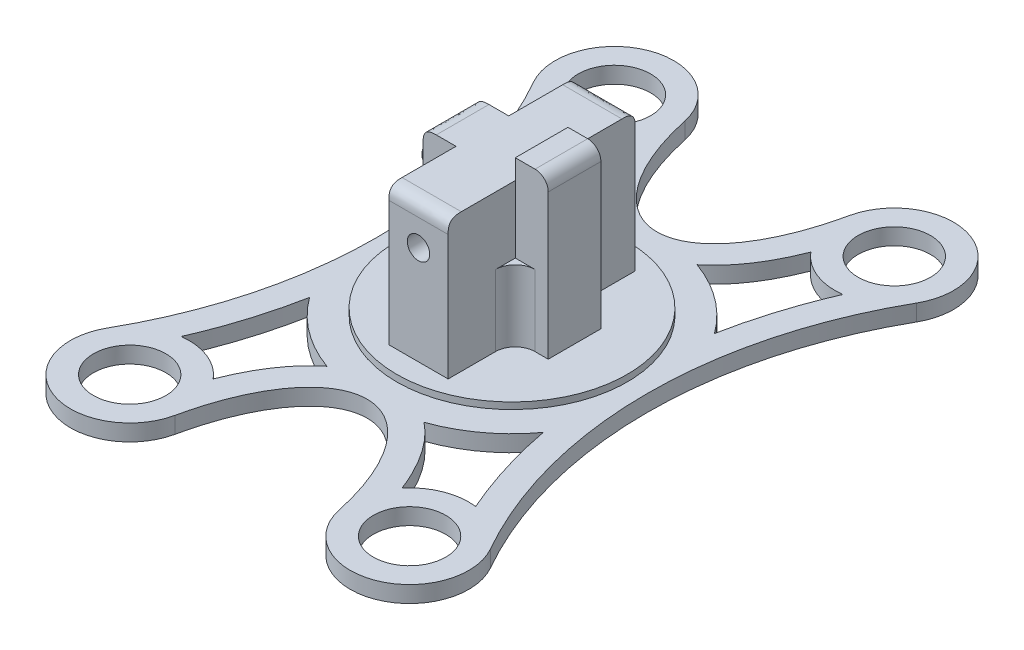
from build123d import *

# Parameters (mm, degrees)
SKETCH1_W                = 100
SKETCH1_H                = 100
BOSS_EXTRUDE1_DEPTH      = 2.5
SKETCH2_W                = 100
SKETCH2_H                = 100
SKETCH2_R                = 5.5
CUT_EXTRUDE1_DEPTH       = 10
CUT_EXTRUDE3_DEPTH       = 10
BOSS_EXTRUDE2_DEPTH      = 1
BOSS_EXTRUDE2_DEPTH_BACK = 4.5
SKETCH6_R                = 17.5
BOSS_EXTRUDE6_DEPTH      = 21
FILLET1_SIZE             = 2
FILLET2_SIZE             = 2
SKETCH12_R               = 1.7
CUT_EXTRUDE4_DEPTH       = 72.5265134
SKETCH13_R               = 1.7
BOSS_EXTRUDE8_DEPTH      = 2.5
SKETCH16_W               = 5
SKETCH16_H               = 8
BOSS_EXTRUDE9_DEPTH      = 24
FILLET3_R                = 2
BOSS_EXTRUDE10_DEPTH     = 10.8


with BuildPart() as part:
    # Sketch1 → Boss-Extrude1 (new body)
    with BuildSketch(Plane(origin=(0, 0, 0), x_dir=(1, 0, 0), z_dir=(0, 1, 0))):
        Rectangle(SKETCH1_W, SKETCH1_H)
    extrude(amount=BOSS_EXTRUDE1_DEPTH)

    # Sketch2 → Cut-Extrude1 (cut)
    # profile 1 of 5: a face of its own
    with BuildSketch(Plane(origin=(0, 2.5, 0), x_dir=(1, 0, 0), z_dir=(0, 1, 0))):
        Rectangle(SKETCH2_W, SKETCH2_H)
        with BuildLine():
            ThreePointArc((-29.074945731, -32.359707621), (-20.523161881, 0), (-29.074945731, 32.359707621))
            ThreePointArc((-29.074945731, 32.359707621), (-24.454355603, 45.216317777), (-12.450207096, 38.693841525))
            add(Edge.make_bspline(
                [(-12.450207096, 38.693841525), (0, -19.342739332), (12.450207096, 38.693841525)],
                knots=[5.128046308, 5.128046308, 5.128046308, 7.438324307, 7.438324307, 7.438324307], degree=2, weights=[1, 0.403791374, 1]))
            ThreePointArc((12.450207096, 38.693841525), (24.454355603, 45.216317777), (29.074945731, 32.359707621))
            ThreePointArc((29.074945731, 32.359707621), (20.523161881, 0), (29.074945731, -32.359707621))
            ThreePointArc((29.074945731, -32.359707621), (24.454355603, -45.216317777), (12.450207096, -38.693841525))
            add(Edge.make_bspline(
                [(12.450207096, -38.693841525), (0, 19.342739332), (-12.450207096, -38.693841525)],
                knots=[5.128046308, 5.128046308, 5.128046308, 7.438324307, 7.438324307, 7.438324307], degree=2, weights=[1, 0.403791374, 1]))
            ThreePointArc((-12.450207096, -38.693841525), (-24.454355603, -45.216317777), (-29.074945731, -32.359707621))
        make_face(mode=Mode.SUBTRACT)
    # profile 2 of 5: a face of its own
    with BuildSketch(Plane(origin=(0, 2.5, 0), x_dir=(1, 0, 0), z_dir=(0, 1, 0))):
        with Locations(Location((-21.25, 36.806079661, 0), (0, 0, 270))):
            Circle(SKETCH2_R)
    # profile 3 of 5: a face of its own
    with BuildSketch(Plane(origin=(0, 2.5, 0), x_dir=(1, 0, 0), z_dir=(0, 1, 0))):
        with Locations(Location((-21.25, -36.806079661, 0), (0, 0, 270))):
            Circle(SKETCH2_R)
    # profile 4 of 5: a face of its own
    with BuildSketch(Plane(origin=(0, 2.5, 0), x_dir=(1, 0, 0), z_dir=(0, 1, 0))):
        with Locations(Location((21.25, -36.806079661, 0), (0, 0, 270))):
            Circle(SKETCH2_R)
    # profile 5 of 5: a face of its own
    with BuildSketch(Plane(origin=(0, 2.5, 0), x_dir=(1, 0, 0), z_dir=(0, 1, 0))):
        with Locations(Location((21.25, 36.806079661, 0), (0, 0, 270))):
            Circle(SKETCH2_R)
    extrude(amount=-CUT_EXTRUDE1_DEPTH, mode=Mode.SUBTRACT)

    # Sketch4 → Cut-Extrude3 (cut)
    with BuildSketch(Plane(origin=(0, 2.5, 0), x_dir=(1, 0, 0), z_dir=(0, 1, 0))):
        with BuildLine():
            ThreePointArc((-17.749489284, -12.998293356), (-13.140045691, -17.64480658), (-7.367625104, -20.729643034))
            add(Edge.make_bspline(
                [(-7.367625104, -20.729643034), (-7.747241798, -21.030061446), (-8.114529726, -21.350348356), (-9.247106431, -22.428016295), (-9.96747496, -23.25295704), (-11.975526868, -25.945450431), (-13.113170007, -28.031524091), (-14.161311212, -30.568863064), (-14.254109179, -30.800153833), (-14.345065296, -31.033569225)],
                knots=[0.658936879, 0.658936879, 0.658936879, 0.658936879, 0.6875, 0.6875, 0.75, 0.75, 0.875, 0.875, 0.887405876, 0.887405876, 0.887405876, 0.887405876], degree=3))
            ThreePointArc((-14.345065296, -31.033569225), (-17.949067849, -28.433275654), (-22.357942029, -27.874536431))
            add(Edge.make_bspline(
                [(-17.749489284, -12.998293356), (-18.730013182, -18.148505445), (-20.279042278, -23.126345909), (-22.357942029, -27.874536431)],
                knots=[0.6784999, 0.6784999, 0.6784999, 0.6784999, 0.896036051, 0.896036051, 0.896036051, 0.896036051], degree=3, weights=[0.94303917, 0.94979881, 0.960677405, 0.975674954]))
        make_face()
        with BuildLine():
            ThreePointArc((7.367625104, -20.729643034), (13.140045691, -17.64480658), (17.749489284, -12.998293356))
            add(Edge.make_bspline(
                [(22.357942029, -27.874536431), (20.279042278, -23.126345909), (18.730013182, -18.148505445), (17.749489284, -12.998293356)],
                knots=[0.103963949, 0.103963949, 0.103963949, 0.103963949, 0.3215001, 0.3215001, 0.3215001, 0.3215001], degree=3, weights=[0.975674954, 0.960677405, 0.94979881, 0.94303917]))
            ThreePointArc((22.357942029, -27.874536431), (17.949067849, -28.433275654), (14.345065296, -31.033569225))
            add(Edge.make_bspline(
                [(14.345065296, -31.033569225), (14.254109179, -30.800153832), (14.161311212, -30.568863064), (13.113170007, -28.031524091), (11.975526868, -25.945450431), (9.96747496, -23.25295704), (9.247106431, -22.428016295), (8.114529726, -21.350348356), (7.747241798, -21.030061447), (7.367625104, -20.729643034)],
                knots=[0.112594124, 0.112594124, 0.112594124, 0.112594124, 0.125, 0.125, 0.25, 0.25, 0.3125, 0.3125, 0.341063121, 0.341063121, 0.341063121, 0.341063121], degree=3))
        make_face()
        with BuildLine():
            ThreePointArc((14.345065296, 31.033569225), (17.949067849, 28.433275654), (22.357942029, 27.874536431))
            add(Edge.make_bspline(
                [(17.749489284, 12.998293356), (18.730013182, 18.148505445), (20.279042278, 23.126345909), (22.357942029, 27.874536431)],
                knots=[0.6784999, 0.6784999, 0.6784999, 0.6784999, 0.896036051, 0.896036051, 0.896036051, 0.896036051], degree=3, weights=[0.94303917, 0.94979881, 0.960677405, 0.975674954]))
            ThreePointArc((17.749489284, 12.998293356), (13.140045691, 17.64480658), (7.367625104, 20.729643034))
            add(Edge.make_bspline(
                [(7.367625104, 20.729643034), (7.747241798, 21.030061446), (8.114529726, 21.350348356), (9.247106431, 22.428016295), (9.96747496, 23.25295704), (11.975526868, 25.945450431), (13.113170007, 28.031524091), (14.161311212, 30.568863064), (14.254109179, 30.800153833), (14.345065296, 31.033569225)],
                knots=[0.658936879, 0.658936879, 0.658936879, 0.658936879, 0.6875, 0.6875, 0.75, 0.75, 0.875, 0.875, 0.887405876, 0.887405876, 0.887405876, 0.887405876], degree=3))
        make_face()
        with BuildLine():
            ThreePointArc((-14.345065296, 31.033569225), (-17.949067849, 28.433275654), (-22.357942029, 27.874536431))
            add(Edge.make_bspline(
                [(-22.357942029, 27.874536431), (-20.279042278, 23.126345909), (-18.730013182, 18.148505445), (-17.749489284, 12.998293356)],
                knots=[0.103963949, 0.103963949, 0.103963949, 0.103963949, 0.3215001, 0.3215001, 0.3215001, 0.3215001], degree=3, weights=[0.975674954, 0.960677405, 0.94979881, 0.94303917]))
            ThreePointArc((-17.749489284, 12.998293356), (-13.140045691, 17.64480658), (-7.367625104, 20.729643034))
            add(Edge.make_bspline(
                [(-14.345065296, 31.033569225), (-14.254109179, 30.800153832), (-14.161311212, 30.568863064), (-13.113170007, 28.031524091), (-11.975526868, 25.945450431), (-9.96747496, 23.25295704), (-9.247106431, 22.428016295), (-8.114529726, 21.350348356), (-7.747241798, 21.030061447), (-7.367625104, 20.729643034)],
                knots=[0.112594124, 0.112594124, 0.112594124, 0.112594124, 0.125, 0.125, 0.25, 0.25, 0.3125, 0.3125, 0.341063121, 0.341063121, 0.341063121, 0.341063121], degree=3))
        make_face()
    extrude(amount=-CUT_EXTRUDE3_DEPTH, mode=Mode.SUBTRACT)

    # Sketch6 → Boss-Extrude2 (add, two sides: drawn at the far end of the back side and taken through both)
    with BuildSketch(Plane(origin=(0, 2.5, 0), x_dir=(1, 0, 0), z_dir=(0, 1, 0)).offset(-BOSS_EXTRUDE2_DEPTH_BACK)):
        with Locations(Location((0, 0, 0), (0, 0, 270))):
            Circle(SKETCH6_R)
    extrude(amount=BOSS_EXTRUDE2_DEPTH + BOSS_EXTRUDE2_DEPTH_BACK)

    # Sketch9 → Boss-Extrude6 (add)
    with BuildSketch(Plane(origin=(0, 3.5, 0), x_dir=(1, 0, 0), z_dir=(0, 1, 0))):
        Polygon((-4.5, 4), (-9.5, 4), (-9.5, -4), (-4.5, -4), (-4.5, -14.2), (4.5, -14.2), (4.5, 14.2), (-4.5, 14.2), align=None)
    extrude(amount=BOSS_EXTRUDE6_DEPTH)

    # Fillet1
    # a fillet whose section is not a circle: 2 mm, written as the material it takes off along each edge
    with BuildSketch(Plane(origin=(-9.5, 24.5, -9), x_dir=(0, -1, 0), z_dir=(0, 0, 1))) as fillet1_piece_1:
        with BuildLine():
            add(Edge.make_bspline([(FILLET1_SIZE, 0), (FILLET1_SIZE * 0.831801948466, 0), (FILLET1_SIZE * 0.663603896932, 0), (FILLET1_SIZE * 0.292893218813, FILLET1_SIZE * 0.0716919198361), (FILLET1_SIZE * 0.0716919198361, FILLET1_SIZE * 0.292893218813), (0, FILLET1_SIZE * 0.663603896932), (0, FILLET1_SIZE * 0.831801948466), (0, FILLET1_SIZE)], knots=[0, 0, 0, 0, 0, 0, 0.5, 0.5, 1, 1, 1, 1, 1, 1], degree=5))
            Line((0, FILLET1_SIZE), (0, 0))
            Line((0, 0), (FILLET1_SIZE, 0))
        make_face()
    extrude(amount=18, mode=Mode.SUBTRACT)

    # Fillet2
    # a fillet whose section is not a circle: 2 mm, written as the material it takes off along each edge
    with BuildSketch(Plane(origin=(-9.5, 24.5, 14.2), x_dir=(0, -1, 0), z_dir=(1, 0, 0)), Plane(origin=(9.5, 24.5, -14.2), x_dir=(0, -1, 0), z_dir=(-1, 0, 0))) as fillet2_piece_1:
        with BuildLine():
            add(Edge.make_bspline([(FILLET2_SIZE, 0), (FILLET2_SIZE * 0.831801948466, 0), (FILLET2_SIZE * 0.663603896932, 0), (FILLET2_SIZE * 0.292893218813, FILLET2_SIZE * 0.0716919198361), (FILLET2_SIZE * 0.0716919198361, FILLET2_SIZE * 0.292893218813), (0, FILLET2_SIZE * 0.663603896932), (0, FILLET2_SIZE * 0.831801948466), (0, FILLET2_SIZE)], knots=[0, 0, 0, 0, 0, 0, 0.5, 0.5, 1, 1, 1, 1, 1, 1], degree=5))
            Line((0, FILLET2_SIZE), (0, 0))
            Line((0, 0), (FILLET2_SIZE, 0))
        make_face()
    extrude(amount=19, mode=Mode.SUBTRACT)

    # Sketch12 → Cut-Extrude4 (cut, through all)
    with BuildSketch(Plane(origin=(0, 0, -14.2), x_dir=(-1, 0, 0), z_dir=(0, 0, -1))):
        with Locations((0, 18.5)):
            Circle(SKETCH12_R)
    extrude(amount=-CUT_EXTRUDE4_DEPTH, mode=Mode.SUBTRACT)

    # Sketch13 → Boss-Extrude8 (add)
    with BuildSketch(Plane.ZY.offset(9.5)):
        with Locations(Location((0, 18.5, 0), (0, 0, 180))):
            Circle(SKETCH13_R)
    extrude(amount=BOSS_EXTRUDE8_DEPTH)

    # Sketch16 → Boss-Extrude9 (add)
    with BuildSketch(Plane(origin=(0, 3.5, 0), x_dir=(1, 0, 0), z_dir=(0, 1, 0))):
        with Locations((7, 0)):
            Rectangle(SKETCH16_W, SKETCH16_H)
    extrude(amount=BOSS_EXTRUDE9_DEPTH)

    # Fillet3
    fillet3_edges = [part.edges().sort_by_distance(p)[0] for p in [
        (9.5, 27.5, 0),
    ]]
    fillet(fillet3_edges, radius=FILLET3_R)

    # Sketch18 → Boss-Extrude10 (add)
    with BuildSketch(Plane(origin=(0, 3.5, 0), x_dir=(1, 0, 0), z_dir=(0, 1, 0))):
        with BuildLine():
            Line((-9.5, -4), (-7.5, -4))
            ThreePointArc((-7.5, -4), (-5.378679656, -4.878679656), (-4.5, -7))
            Line((-4.5, -7), (-4.5, -14.2))
            Line((-4.5, -14.2), (4.5, -14.2))
            Line((4.5, -14.2), (4.5, -7))
            ThreePointArc((4.5, -7), (5.378679656, -4.878679656), (7.5, -4))
            Line((7.5, -4), (9.5, -4))
            Line((9.5, -4), (9.5, 4))
            Line((9.5, 4), (7.5, 4))
            ThreePointArc((7.5, 4), (5.378679656, 4.878679656), (4.5, 7))
            Line((4.5, 7), (4.5, 14.2))
            Line((4.5, 14.2), (-4.5, 14.2))
            Line((-4.5, 14.2), (-4.5, 7))
            ThreePointArc((-4.5, 7), (-5.378679656, 4.878679656), (-7.5, 4))
            Line((-7.5, 4), (-9.5, 4))
            Line((-9.5, 4), (-9.5, -4))
        make_face()
    extrude(amount=BOSS_EXTRUDE10_DEPTH)


solid = part.part
